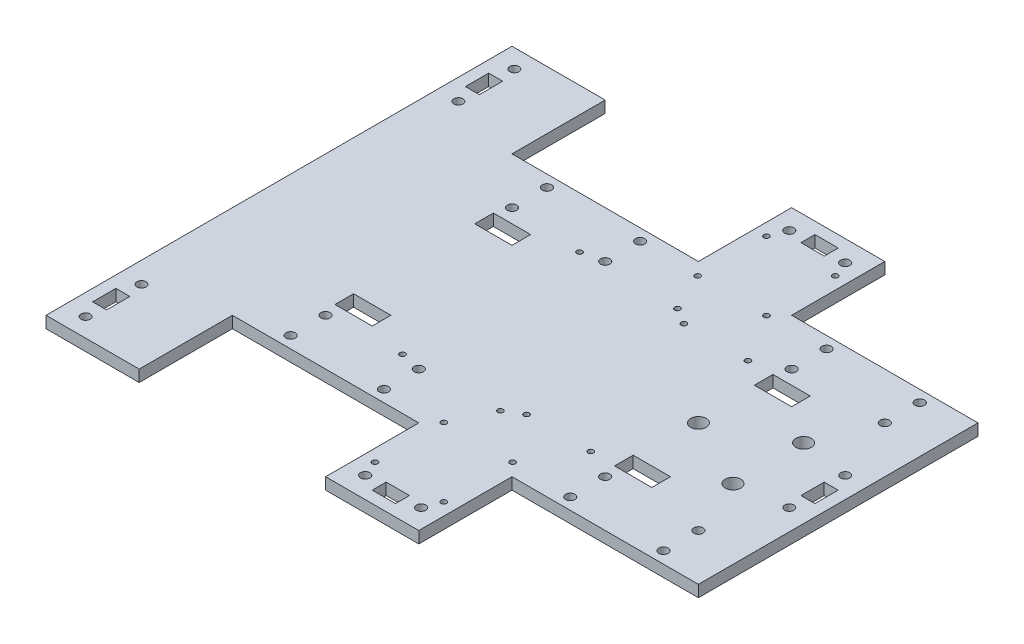
from build123d import *

# Parameters (mm, degrees)
BOSS_EXTRUDE1_DEPTH   = 6.35
SKETCH2_W             = 12.7
SKETCH2_H             = 7.62
CUT_EXTRUDE1_DEPTH    = 326.340686819
SKETCH3_R             = 2.54
CUT_EXTRUDE2_DEPTH    = 326.340686819
F_5_0MM_DOWEL_HOLE1_D = 5
SKETCH6_W             = 12.7
SKETCH6_H             = 7.62
SKETCH6_W_2           = 7.62
SKETCH6_H_2           = 12.7
CUT_EXTRUDE3_DEPTH    = 326.340686819
SKETCH7_W             = 20.32
SKETCH7_H             = 10.16
CUT_EXTRUDE4_DEPTH    = 326.340686819
F_3_0MM_DOWEL_HOLE1_D = 3
F_8_0MM_DOWEL_HOLE1_D = 8.5


with BuildPart() as part:
    # Sketch1 → Boss-Extrude1 (new body)
    with BuildSketch(Plane(origin=(0, 0, 0), x_dir=(1, 0, 0), z_dir=(0, 1, 0))):
        Polygon((0, 152.4), (101.6, 152.4), (101.6, 203.2), (152.4, 203.2), (152.4, 152.4), (254, 152.4), (254, 0), (152.4, 0), (152.4, -50.8), (101.6, -50.8), (101.6, 0), (0, 0), (0, -50.8), (-50.8, -50.8), (-50.8, 203.2), (0, 203.2), align=None)
    extrude(amount=BOSS_EXTRUDE1_DEPTH)

    # Sketch2 → Cut-Extrude1 (cut, through all)
    with BuildSketch(Plane(origin=(0, 6.35, 0), x_dir=(1, 0, 0), z_dir=(0, 1, 0))):
        with Locations((127, 193.04)):
            Rectangle(SKETCH2_W, SKETCH2_H)
    extrude(amount=-CUT_EXTRUDE1_DEPTH, mode=Mode.SUBTRACT)

    # Sketch3 → Cut-Extrude2 (cut, through all)
    with BuildSketch(Plane.XZ):
        with Locations((228.6, -146.05)):
            Circle(SKETCH3_R)
        with Locations((177.8, -146.05)):
            Circle(SKETCH3_R)
        with Locations((228.6, -127)):
            Circle(SKETCH3_R)
        with Locations((177.8, -127)):
            Circle(SKETCH3_R)
        with Locations((177.8, -25.4)):
            Circle(SKETCH3_R)
        with Locations((228.6, -25.4)):
            Circle(SKETCH3_R)
        with Locations((177.8, -6.35)):
            Circle(SKETCH3_R)
        with Locations((228.6, -6.35)):
            Circle(SKETCH3_R)
        with Locations((25.4, -6.35)):
            Circle(SKETCH3_R)
        with Locations((76.2, -6.35)):
            Circle(SKETCH3_R)
        with Locations((25.4, -25.4)):
            Circle(SKETCH3_R)
        with Locations((76.2, -25.4)):
            Circle(SKETCH3_R)
        with Locations((76.2, -127)):
            Circle(SKETCH3_R)
        with Locations((25.4, -127)):
            Circle(SKETCH3_R)
        with Locations((76.2, -146.05)):
            Circle(SKETCH3_R)
        with Locations((25.4, -146.05)):
            Circle(SKETCH3_R)
        with Locations((142.24, -191.77)):
            Circle(SKETCH3_R)
        with Locations((111.76, -191.77)):
            Circle(SKETCH3_R)
        with Locations((142.24, 39.37)):
            Circle(SKETCH3_R)
        with Locations((111.76, 39.37)):
            Circle(SKETCH3_R)
    extrude(amount=-CUT_EXTRUDE2_DEPTH, mode=Mode.SUBTRACT)

    # Ø5.0mm Dowel Hole1 (through all)
    with Locations(Plane(origin=(-39.37, 6.35, 40.64), x_dir=(0, 0, 1), z_dir=(0, 1, 0))):
        with Locations((0, 0), (-30.48, 0), (-203.2, 0), (-233.68, 0), (-101.6, 281.94), (-132.08, 281.94)):
            Hole(F_5_0MM_DOWEL_HOLE1_D / 2)

    # Sketch6 → Cut-Extrude3 (cut, through all)
    with BuildSketch(Plane(origin=(0, 6.35, 0), x_dir=(1, 0, 0), z_dir=(0, 1, 0))):
        with Locations((127, -40.64)):
            Rectangle(SKETCH6_W, SKETCH6_H)
        with Locations((-40.64, -25.4)):
            Rectangle(SKETCH6_W_2, SKETCH6_H_2)
        with Locations((-40.64, 177.8)):
            Rectangle(SKETCH6_W_2, SKETCH6_H_2)
        with Locations((243.84, 76.2)):
            Rectangle(SKETCH6_W_2, SKETCH6_H_2)
    extrude(amount=-CUT_EXTRUDE3_DEPTH, mode=Mode.SUBTRACT)

    # Sketch7 → Cut-Extrude4 (cut, through all)
    with BuildSketch(Plane(origin=(0, 6.35, 0), x_dir=(1, 0, 0), z_dir=(0, 1, 0))):
        with Locations((33.02, 38.1)):
            Rectangle(SKETCH7_W, SKETCH7_H)
        with Locations((33.02, 114.3)):
            Rectangle(SKETCH7_W, SKETCH7_H)
        with Locations((185.42, 38.1)):
            Rectangle(SKETCH7_W, SKETCH7_H)
        with Locations((185.42, 114.3)):
            Rectangle(SKETCH7_W, SKETCH7_H)
    extrude(amount=-CUT_EXTRUDE4_DEPTH, mode=Mode.SUBTRACT)

    # Ø3.0mm Dowel Hole1 (through all)
    with Locations(Plane(origin=(161.925, 6.35, -33.3375), x_dir=(0, 0, 1), z_dir=(0, 1, 0))):
        with Locations((0, 0), (-85.725, 0), (-85.725, -34.925), (0, -34.925), (-91.1225, -43.815), (5.3975, -43.815), (5.3975, -97.155), (-91.1225, -97.155), (-149.5425, -53.731928242), (-112.0425, -53.731928242), (-112.0425, -16.231928242), (-149.5425, -16.231928242), (63.8175, -16.231928242), (63.8175, -53.731928242), (26.3175, -53.731928242), (26.3175, -16.231928242)):
            Hole(F_3_0MM_DOWEL_HOLE1_D / 2)

    # Ø8.0mm Dowel Hole1 (through all)
    with Locations(Plane(origin=(215.9, 6.35, -56.950000019), x_dir=(0, 0, 1), z_dir=(0, 1, 0))):
        with Locations((0, 0), (-38.499999962, 0), (-19.249999981, -38.1)):
            Hole(F_8_0MM_DOWEL_HOLE1_D / 2)


solid = part.part
